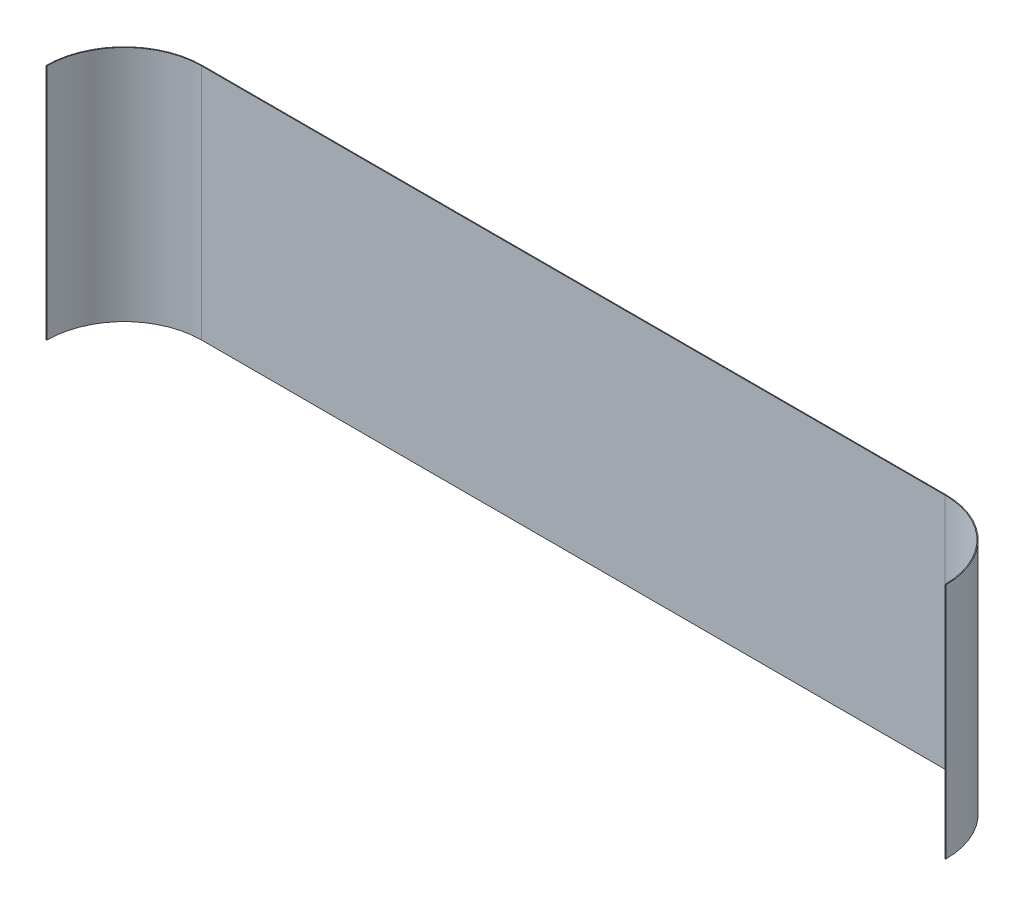
from build123d import *

# Parameters (mm, degrees)
BASE_FLANGE1_DEPTH = 230


# Sheet-metal steps are written as plain solids
with BuildPart() as part:
    # Sketch1 → Base-Flange1 (new body)
    with BuildSketch(Plane(origin=(0, 0, 0), x_dir=(1, 0, 0), z_dir=(0, 1, 0))):
        with BuildLine():
            ThreePointArc((-494.25, -36), (-472.283008589, 17.033008589), (-419.25, 39))
            Line((-419.25, 39), (300.75, 39))
            ThreePointArc((300.75, 39), (353.783008589, 17.033008589), (375.75, -36))
            Line((375.75, -36), (376.55, -36))
            ThreePointArc((376.55, -36), (354.348694014, 17.598694014), (300.75, 39.8))
            Line((300.75, 39.8), (-419.25, 39.8))
            ThreePointArc((-419.25, 39.8), (-472.848694014, 17.598694014), (-495.05, -36))
            Line((-495.05, -36), (-494.25, -36))
        make_face()
    extrude(amount=BASE_FLANGE1_DEPTH)


solid = part.part
